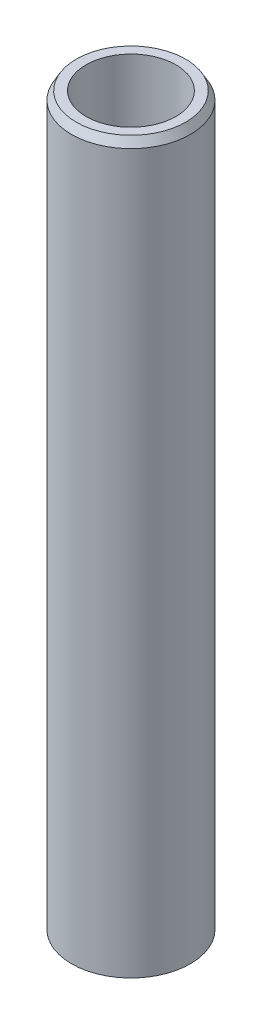
from build123d import *
from OCP.BRepFilletAPI import BRepFilletAPI_MakeChamfer

# Parameters (mm, degrees)
SKETCH1_R           = 32.5
BOSS_EXTRUDE1_DEPTH = 399.860888022
SKETCH2_R           = 24.536084134
CUT_EXTRUDE1_DEPTH  = 403.493763641
CHAMFER1_SIZE       = 4.499223498
CHAMFER1_SIZE2      = 2.597627898


with BuildPart() as part:
    # Sketch1 → Boss-Extrude1 (new body)
    with BuildSketch(Plane(origin=(0, 0, 0), x_dir=(1, 0, 0), z_dir=(0, 1, 0))):
        Circle(SKETCH1_R)
    extrude(amount=BOSS_EXTRUDE1_DEPTH)

    # Sketch2 → Cut-Extrude1 (cut, through all)
    with BuildSketch(Plane(origin=(0, 0, 0), x_dir=(1, 0, 0), z_dir=(0, 1, 0))):
        Circle(SKETCH2_R)
    extrude(amount=CUT_EXTRUDE1_DEPTH, mode=Mode.SUBTRACT)

    # Chamfer1: one chamfer whose edges measure the first distance from different faces: ONE call of the kernel's chamfer builder (chamfer() names one face for all edges)
    chamfer1_edges_1 = [part.edges().sort_by_distance(p)[0] for p in [
        (-32.5, 399.860888022, 0),
    ]]
    chamfer1_side_1 = [part.faces().sort_by_distance(p)[0] for p in [
        (-32.5, 199.930444011, 0),
    ]]
    chamfer1_edges_2 = [part.edges().sort_by_distance(p)[0] for p in [
        (-32.5, 0, 0),
    ]]
    chamfer1_side_2 = [part.faces().sort_by_distance(p)[0] for p in [
        (-31.580761184, 0, 0),
    ]]
    chamfer1 = BRepFilletAPI_MakeChamfer(part.part.solid().wrapped)
    for e in chamfer1_edges_1:
        chamfer1.Add(CHAMFER1_SIZE, CHAMFER1_SIZE2, e.wrapped, chamfer1_side_1[0].wrapped)  # the first distance lies on this face
    for e in chamfer1_edges_2:
        chamfer1.Add(CHAMFER1_SIZE, CHAMFER1_SIZE2, e.wrapped, chamfer1_side_2[0].wrapped)  # the first distance lies on this face
    add(Compound.cast(chamfer1.Shape()), mode=Mode.REPLACE)


solid = part.part
